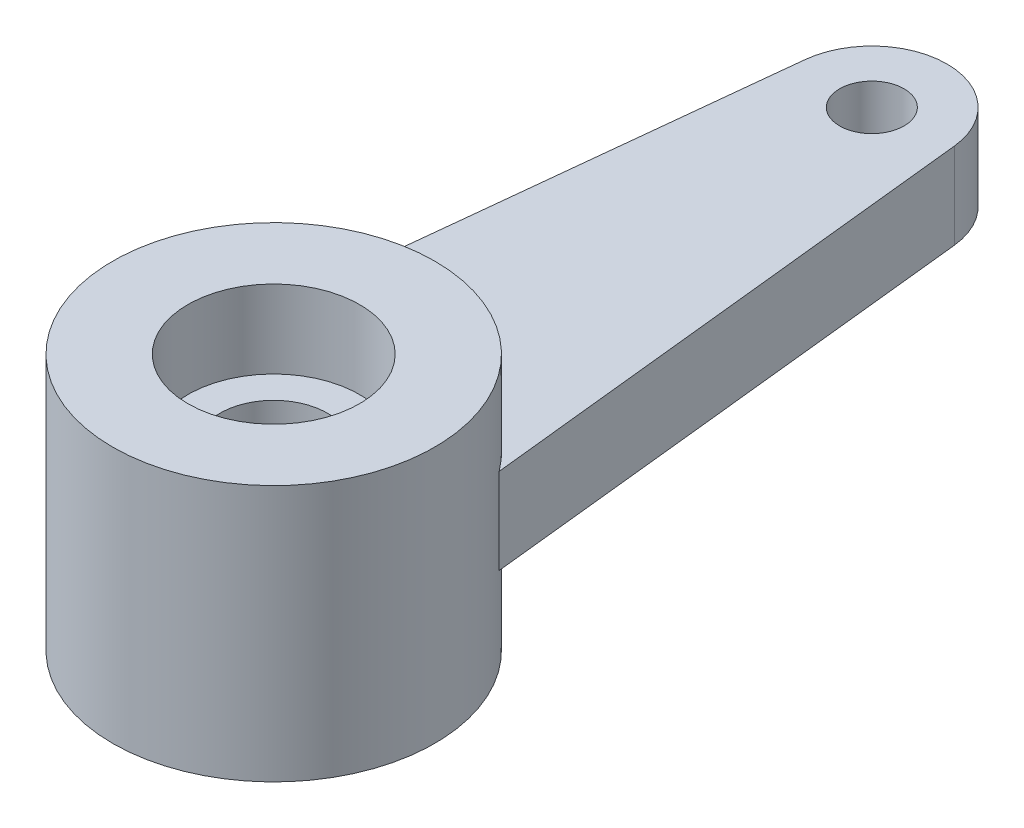
from build123d import *

# Parameters (mm, degrees)
SKETCH1_R                = 7.5
BOSS_EXTRUDE1_DEPTH      = 5.975
ROD_CUTOUT_DEPTH         = 16.978188258
ROD_CUTOUT_DEPTH_BACK    = 16.978188258
SKETCH2_R                = 2.5
SKETCH3_R                = 4
BEARING_CUTOUT_DEPTH     = 3.63
STEERINGLINK_MOUNT_DEPTH = 2
SKETCH5_R                = 2.5
CUT_EXTRUDE3_DEPTH       = 35.378408922
SKETCH6_R                = 1.5
LINKAGEMOUNT_HOLE_DEPTH  = 10


with BuildPart() as part:
    # Sketch1 → Boss-Extrude1 (new, symmetric)
    with BuildSketch(Plane(origin=(0, 0, 0), x_dir=(1, 0, 0), z_dir=(0, 1, 0))):
        Circle(SKETCH1_R)
    extrude(amount=BOSS_EXTRUDE1_DEPTH, both=True)

    # Sketch2 → Rod-Cutout (cut, two sides: drawn at the far end of the back side and taken through both)
    with BuildSketch(Plane(origin=(0, 5.975, 0), x_dir=(1, 0, 0), z_dir=(0, 1, 0)).offset(-ROD_CUTOUT_DEPTH_BACK)):
        Circle(SKETCH2_R)
    extrude(amount=ROD_CUTOUT_DEPTH + ROD_CUTOUT_DEPTH_BACK, mode=Mode.SUBTRACT)

    # Sketch3 → Bearing-Cutout (cut)
    with BuildSketch(Plane(origin=(0, 5.975, 0), x_dir=(1, 0, 0), z_dir=(0, 1, 0))):
        Circle(SKETCH3_R)
    bearing_cutout = extrude(amount=-BEARING_CUTOUT_DEPTH, mode=Mode.SUBTRACT)

    # Mirror1: Bearing-Cutout across plane
    add(bearing_cutout.mirror(Plane.ZX), mode=Mode.SUBTRACT)

    # Sketch4 → SteeringLink-Mount (add, symmetric)
    with BuildSketch(Plane(origin=(0, 0, 0), x_dir=(1, 0, 0), z_dir=(0, 1, 0))):
        with BuildLine():
            Line((-6, 0), (6, 0))
            Line((6, 0), (6, 4.5))
            Line((6, 4.5), (3.480419684, 28.21970099))
            ThreePointArc((3.480419684, 28.21970099), (0, 31.35), (-3.480419684, 28.21970099))
            Line((-3.480419684, 28.21970099), (-6, 4.5))
            Line((-6, 4.5), (-6, 0))
        make_face()
    extrude(amount=STEERINGLINK_MOUNT_DEPTH, both=True)

    # Sketch5 → Cut-Extrude3 (cut, through all)
    with BuildSketch(Plane(origin=(0, 5.975, 0), x_dir=(1, 0, 0), z_dir=(0, 1, 0))):
        Circle(SKETCH5_R)
    extrude(amount=-CUT_EXTRUDE3_DEPTH, mode=Mode.SUBTRACT)

    # Sketch6 → LinkageMount-Hole (cut)
    with BuildSketch(Plane(origin=(0, 2, 0), x_dir=(1, 0, 0), z_dir=(0, 1, 0))):
        with Locations((0, 27.85)):
            Circle(SKETCH6_R)
    extrude(amount=-LINKAGEMOUNT_HOLE_DEPTH, mode=Mode.SUBTRACT)


solid = part.part
